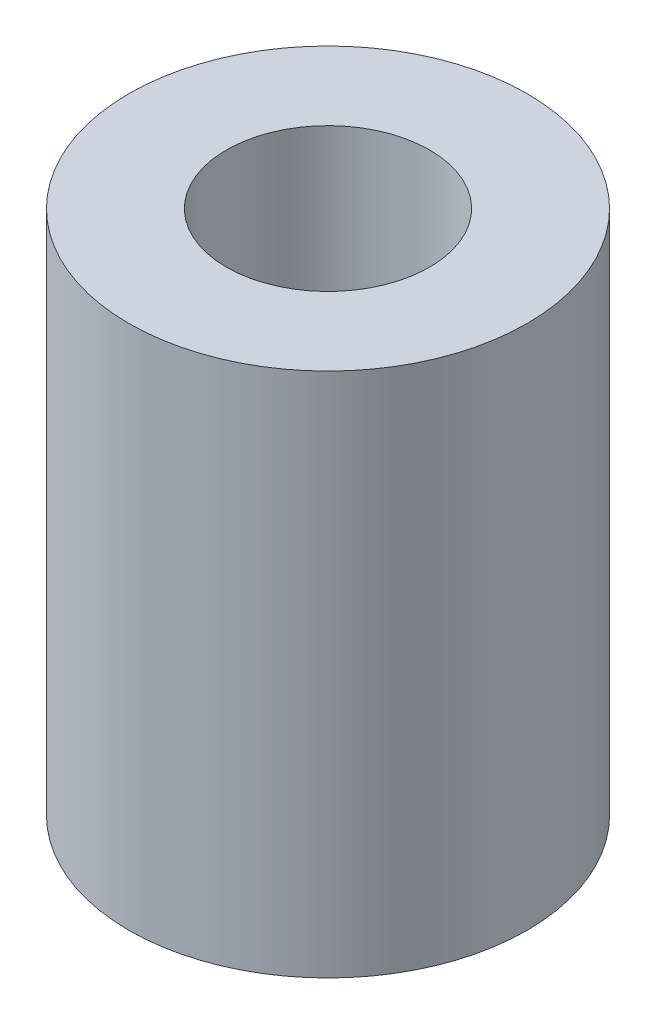
from build123d import *

# Parameters (mm, degrees)
SKETCH1_R           = 7.9375
BOSS_EXTRUDE1_DEPTH = 20.955
SKETCH3_R           = 4.05
CUT_EXTRUDE2_DEPTH  = 24.772249315


with BuildPart() as part:
    # Sketch1 → Boss-Extrude1 (new body)
    with BuildSketch(Plane(origin=(0, 0, 0), x_dir=(1, 0, 0), z_dir=(0, 1, 0))):
        Circle(SKETCH1_R)
    extrude(amount=BOSS_EXTRUDE1_DEPTH)

    # Sketch3 → Cut-Extrude2 (cut, through all)
    with BuildSketch(Plane(origin=(0, 20.955, 0), x_dir=(1, 0, 0), z_dir=(0, 1, 0))):
        Circle(SKETCH3_R)
    extrude(amount=-CUT_EXTRUDE2_DEPTH, mode=Mode.SUBTRACT)


solid = part.part
